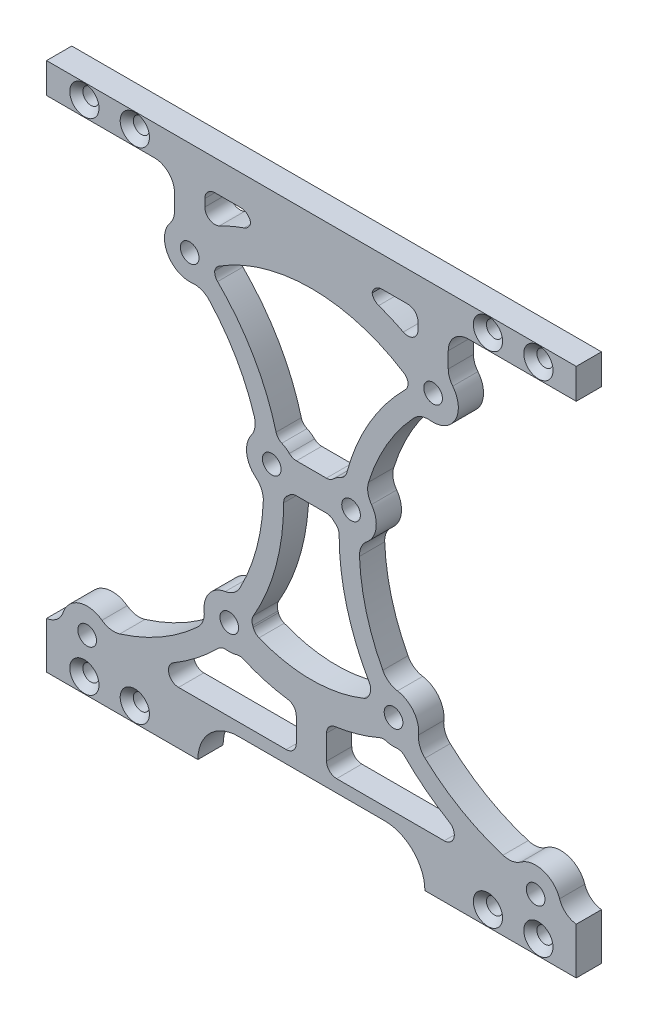
from build123d import *

# Parameters (mm, degrees)
SKETCH_1_R           = 1.85
SKETCH_1_R_2         = 37
SKETCH_1_R_3         = 2.1
EXTRUDE_1_DEPTH      = 5
FILLET_1_R           = 2.5
SKETCH_2_W           = 105
SKETCH_2_H           = 2.5
CUT_EXTRUDE_1_DEPTH  = 10
SKETCH_3_OUTSIDE_W   = 247.662
SKETCH_3_OUTSIDE_H   = 157.662
SKETCH_3_OUTSIDE_W_2 = 105
SKETCH_3_OUTSIDE_H_2 = 105
CUT_EXTRUDE_2_DEPTH  = 10
SKETCH_5_R           = 1.6
CUT_EXTRUDE_3_DEPTH  = 10
SKETCH_6_OUTSIDE_W   = 136.716
SKETCH_6_OUTSIDE_H   = 136.716
CUT_EXTRUDE_4_DEPTH  = 10
FILLET_2_R           = 4
FILLET_3_R           = 2
CUT_EXTRUDE_5_DEPTH  = 10
CHAMFER_1_SIZE       = 1.3


with BuildPart() as part:
    # 草图1 → 凸台-拉伸1 (new body)
    with BuildSketch(Plane.XY):
        with BuildLine():
            Line((-55, 49.749371855), (-55, 55))
            Line((-55, 55), (55, 55))
            Line((55, 55), (55, 49.749371855))
            ThreePointArc((55, 49.749371855), (100, 0), (55, -49.749371855))
            Line((55, -49.749371855), (55, -55))
            Line((55, -55), (-55, -55))
            Line((-55, -55), (-55, -49.749371855))
            ThreePointArc((-55, -49.749371855), (-100, 0), (-55, 49.749371855))
        make_face()
        with Locations((-44.452636831, -42.136406608)):
            Circle(SKETCH_1_R, mode=Mode.SUBTRACT)
        with Locations((-75.872360733, -33.717516962)):
            Circle(SKETCH_1_R, mode=Mode.SUBTRACT)
        with Locations((-92.136406608, -5.547363169)):
            Circle(SKETCH_1_R, mode=Mode.SUBTRACT)
        with Locations((-83.717516962, 25.872360733)):
            Circle(SKETCH_1_R, mode=Mode.SUBTRACT)
        with Locations((-55.547363169, 42.136406608)):
            Circle(SKETCH_1_R, mode=Mode.SUBTRACT)
        with Locations((-24.127639267, 33.717516962)):
            Circle(SKETCH_1_R, mode=Mode.SUBTRACT)
        with Locations((-7.863593392, 5.547363169)):
            Circle(SKETCH_1_R, mode=Mode.SUBTRACT)
        with Locations((-16.282483038, -25.872360733)):
            Circle(SKETCH_1_R, mode=Mode.SUBTRACT)
        with Locations((-50, 0)):
            Circle(SKETCH_1_R_2, mode=Mode.SUBTRACT)
        with Locations(Location((50, 0, 0), (0, 0, 180))):
            Circle(SKETCH_1_R_2, mode=Mode.SUBTRACT)
        with Locations(Location((16.282483038, -25.872360733, 0), (0, 0, 180))):
            Circle(SKETCH_1_R, mode=Mode.SUBTRACT)
        with Locations(Location((7.863593392, 5.547363169, 0), (0, 0, 180))):
            Circle(SKETCH_1_R, mode=Mode.SUBTRACT)
        with Locations(Location((24.127639267, 33.717516962, 0), (0, 0, 180))):
            Circle(SKETCH_1_R, mode=Mode.SUBTRACT)
        with Locations(Location((55.547363169, 42.136406608, 0), (0, 0, 180))):
            Circle(SKETCH_1_R, mode=Mode.SUBTRACT)
        with Locations(Location((83.717516962, 25.872360733, 0), (0, 0, 180))):
            Circle(SKETCH_1_R, mode=Mode.SUBTRACT)
        with Locations(Location((92.136406608, -5.547363169, 0), (0, 0, 180))):
            Circle(SKETCH_1_R, mode=Mode.SUBTRACT)
        with Locations(Location((75.872360733, -33.717516962, 0), (0, 0, 180))):
            Circle(SKETCH_1_R, mode=Mode.SUBTRACT)
        with Locations(Location((44.452636831, -42.136406608, 0), (0, 0, 180))):
            Circle(SKETCH_1_R, mode=Mode.SUBTRACT)
        with Locations(Location((8, -47.5, 0), (0, 0, 180))):
            Circle(SKETCH_1_R_3, mode=Mode.SUBTRACT)
        with Locations((-8, -47.5)):
            Circle(SKETCH_1_R_3, mode=Mode.SUBTRACT)
    extrude(amount=EXTRUDE_1_DEPTH)

    # 圆角1
    fillet_1_edges = [part.edges().sort_by_distance(p)[0] for p in [
        (-55, 49.749371855, 2.5),
        (-55, 55, 2.5),
        (55, 55, 2.5),
        (55, 49.749371855, 2.5),
        (55, -49.749371855, 2.5),
        (55, -55, 2.5),
        (-55, -55, 2.5),
        (-55, -49.749371855, 2.5),
    ]]
    fillet(fillet_1_edges, radius=FILLET_1_R)

    # 草图2 → 切除-拉伸1 (cut)
    with BuildSketch(Plane.XY.offset(5)):
        with Locations((0, 53.75)):
            Rectangle(SKETCH_2_W, SKETCH_2_H)
        with Locations((0, -53.75)):
            Rectangle(SKETCH_2_W, SKETCH_2_H)
    extrude(amount=-CUT_EXTRUDE_1_DEPTH, mode=Mode.SUBTRACT)

    # 草图3 outside → 切除-拉伸2 (cut)
    with BuildSketch(Plane.XY.offset(5)):
        Rectangle(SKETCH_3_OUTSIDE_W, SKETCH_3_OUTSIDE_H)
        Rectangle(SKETCH_3_OUTSIDE_W_2, SKETCH_3_OUTSIDE_H_2, mode=Mode.SUBTRACT)
    extrude(amount=-CUT_EXTRUDE_2_DEPTH, mode=Mode.SUBTRACT)

    # 草图5 → 切除-拉伸3 (cut)
    with BuildSketch(Plane.XY.offset(5)):
        with Locations((-45, 49.5)):
            Circle(SKETCH_5_R)
        with Locations((-35, 49.5)):
            Circle(SKETCH_5_R)
        with Locations((35, 49.5)):
            Circle(SKETCH_5_R)
        with Locations((45, 49.5)):
            Circle(SKETCH_5_R)
        with Locations((45, -49.5)):
            Circle(SKETCH_5_R)
        with Locations((35, -49.5)):
            Circle(SKETCH_5_R)
        with Locations((-35, -49.5)):
            Circle(SKETCH_5_R)
        with Locations((-45, -49.5)):
            Circle(SKETCH_5_R)
    extrude(amount=-CUT_EXTRUDE_3_DEPTH, mode=Mode.SUBTRACT)

    # 草图6 outside → 切除-拉伸4 (cut)
    # profile 1 of 7: a face of its own
    with BuildSketch(Plane.XY.offset(5)):
        Rectangle(SKETCH_6_OUTSIDE_W, SKETCH_6_OUTSIDE_H)
        with BuildLine():
            Line((-52.5, 46.5), (-52.5, 52.5))
            Line((-52.5, 52.5), (52.5, 52.5))
            Line((52.5, 52.5), (52.5, 46.5))
            Line((52.5, 46.5), (27.127639267, 46.5))
            Line((27.127639267, 46.5), (27.127639267, 37.717516962))
            ThreePointArc((27.127639267, 37.717516962), (28.39848316, 31.117537647), (21.951951232, 29.215697156))
            ThreePointArc((21.951951232, 29.215697156), (14.925971147, 20.25), (10.67443969, 9.682474182))
            ThreePointArc((10.67443969, 9.682474182), (12.820817698, 4.894732208), (9.508416941, 0.825652093))
            ThreePointArc((9.508416941, 0.825652093), (10.880004035, -10.482171327), (15.346086478, -20.960827216))
            ThreePointArc((15.346086478, -20.960827216), (20.249249739, -22.828553588), (20.784302844, -28.048048768))
            ThreePointArc((20.784302844, -28.048048768), (29.75, -35.074028853), (40.317525818, -39.32556031))
            ThreePointArc((40.317525818, -39.32556031), (46.430040326, -37.544035171), (49.336261078, -43.208887012))
            Line((49.336261078, -43.208887012), (52.5, -43.263142848))
            Line((52.5, -43.263142848), (52.5, -52.5))
            Line((52.5, -52.5), (-52.5, -52.5))
            Line((-52.5, -52.5), (-52.5, -43.263142848))
            Line((-52.5, -43.263142848), (-49.336261078, -43.208887012))
            ThreePointArc((-49.336261078, -43.208887012), (-46.430040326, -37.544035171), (-40.317525818, -39.32556031))
            ThreePointArc((-40.317525818, -39.32556031), (-29.75, -35.074028853), (-20.784302844, -28.048048768))
            ThreePointArc((-20.784302844, -28.048048768), (-20.249249739, -22.828553588), (-15.346086478, -20.960827216))
            ThreePointArc((-15.346086478, -20.960827216), (-10.880004035, -10.482171327), (-9.508416941, 0.825652093))
            ThreePointArc((-9.508416941, 0.825652093), (-12.820817698, 4.894732208), (-10.67443969, 9.682474182))
            ThreePointArc((-10.67443969, 9.682474182), (-14.925971147, 20.25), (-21.951951232, 29.215697156))
            ThreePointArc((-21.951951232, 29.215697156), (-28.39848316, 31.117537647), (-27.127639267, 37.717516962))
            Line((-27.127639267, 37.717516962), (-27.127639267, 46.5))
            Line((-27.127639267, 46.5), (-52.5, 46.5))
        make_face(mode=Mode.SUBTRACT)
    # profile 2 of 7: a face of its own
    with BuildSketch(Plane.XY.offset(5)):
        with BuildLine():
            Line((-3.863593392, 2.547363169), (3.863593392, 2.547363169))
            ThreePointArc((3.863593392, 2.547363169), (4.611266381, 1.749683744), (5.514440588, 1.133580086))
            ThreePointArc((5.514440588, 1.133580086), (7.01630073, -11.517447507), (12.041165491, -23.224488858))
            ThreePointArc((12.041165491, -23.224488858), (11.591694493, -24.141319767), (11.337848721, -25.130342222))
            ThreePointArc((11.337848721, -25.130342222), (0, -27.569564991), (-11.337848721, -25.130342222))
            ThreePointArc((-11.337848721, -25.130342222), (-11.591694493, -24.141319767), (-12.041165491, -23.224488858))
            ThreePointArc((-12.041165491, -23.224488858), (-7.01630073, -11.517447507), (-5.514440588, 1.133580086))
            ThreePointArc((-5.514440588, 1.133580086), (-4.611266381, 1.749683744), (-3.863593392, 2.547363169))
        make_face()
    # profile 3 of 7: a face of its own
    with BuildSketch(Plane.XY.offset(5)):
        with BuildLine():
            Line((-3.863593392, 8.547363169), (3.863593392, 8.547363169))
            ThreePointArc((3.863593392, 8.547363169), (5.134787124, 9.737066781), (6.736857152, 10.418755726))
            ThreePointArc((6.736857152, 10.418755726), (11.461869532, 22.25), (19.345521441, 32.257602891))
            ThreePointArc((19.345521441, 32.257602891), (19.178901092, 33.003380788), (19.127872778, 33.765839392))
            ThreePointArc((19.127872778, 33.765839392), (0, 39.637800499), (-19.127872778, 33.765839392))
            ThreePointArc((-19.127872778, 33.765839392), (-19.178901092, 33.003380788), (-19.345521441, 32.257602891))
            ThreePointArc((-19.345521441, 32.257602891), (-11.461869532, 22.25), (-6.736857152, 10.418755726))
            ThreePointArc((-6.736857152, 10.418755726), (-5.134787124, 9.737066781), (-3.863593392, 8.547363169))
        make_face()
    # profile 4 of 7: a face of its own
    with BuildSketch(Plane.XY.offset(5)):
        with BuildLine():
            Line((21.127639267, 46.5), (21.127639267, 39.618847204))
            ThreePointArc((21.127639267, 39.618847204), (16.695210543, 41.996136951), (12, 43.799724734))
            Line((12, 43.799724734), (12, 46.5))
            Line((12, 46.5), (21.127639267, 46.5))
        make_face()
    # profile 5 of 7: a face of its own
    with BuildSketch(Plane.XY.offset(5)):
        with BuildLine():
            Line((-21.127639267, 46.5), (-21.127639267, 39.618847204))
            ThreePointArc((-21.127639267, 39.618847204), (-16.695210543, 41.996136952), (-12, 43.799724734))
            Line((-12, 43.799724734), (-12, 46.5))
            Line((-12, 46.5), (-21.127639267, 46.5))
        make_face()
    # profile 6 of 7: a face of its own
    with BuildSketch(Plane.XY.offset(5)):
        with BuildLine():
            Line((3, -42.025445209), (3, -33.435246279))
            ThreePointArc((3, -33.435246279), (8.731461368, -32.414152404), (14.200321769, -30.418194479))
            ThreePointArc((14.200321769, -30.418194479), (15.949683646, -30.861272895), (17.742397109, -30.654478559))
            ThreePointArc((17.742397109, -30.654478559), (25.875392665, -37.393225602), (35.367435119, -42.025445209))
            Line((35.367435119, -42.025445209), (3, -42.025445209))
        make_face()
    # profile 7 of 7: a face of its own
    with BuildSketch(Plane.XY.offset(5)):
        with BuildLine():
            Line((-3, -42.025445209), (-3, -33.435246279))
            ThreePointArc((-3, -33.435246279), (-8.731461368, -32.414152404), (-14.200321769, -30.418194479))
            ThreePointArc((-14.200321769, -30.418194479), (-15.949683646, -30.861272895), (-17.742397109, -30.654478559))
            ThreePointArc((-17.742397109, -30.654478559), (-25.875392665, -37.393225602), (-35.367435119, -42.025445209))
            Line((-35.367435119, -42.025445209), (-3, -42.025445209))
        make_face()
    extrude(amount=-CUT_EXTRUDE_4_DEPTH, mode=Mode.SUBTRACT)

    # 圆角2
    # the kernel refuses this fillet: 4 mm, written as the material it adds along each edge
    with BuildSketch(Plane(origin=(27.127639267, 46.5, 5), x_dir=(0, -1, 0), z_dir=(0, 0, -1)), Plane(origin=(-27.127639267, 46.5, 5), x_dir=(-1, 0, 0), z_dir=(0, 0, -1))) as fillet_2_piece_1:
        with BuildLine():
            CenterArc((FILLET_2_R, -FILLET_2_R), FILLET_2_R, 90, 90)
            Line((0, -FILLET_2_R), (-FILLET_2_R * 0.02, -FILLET_2_R))
            Line((-FILLET_2_R * 0.02, -FILLET_2_R), (-FILLET_2_R * 0.02, FILLET_2_R * 0.02))
            Line((-FILLET_2_R * 0.02, FILLET_2_R * 0.02), (FILLET_2_R, FILLET_2_R * 0.02))
            Line((FILLET_2_R, FILLET_2_R * 0.02), (FILLET_2_R, 0))
        make_face()
    extrude(amount=5)
    with BuildSketch(Plane(origin=(27.127639267, 37.717516962, 5), x_dir=(0.7197794183557561, -0.6942028442115816, 0), z_dir=(0, 0, -1))) as fillet_2_piece_2:
        with BuildLine():
            CenterArc((1.728924741, -3.969380965), FILLET_2_R, 97.093830543, 38.942441269)
            Line((-1.150192932, -1.192569588), (-1.207775286, -1.13703336))
            Line((-1.207775286, -1.13703336), (-0.057582353, 0.055536228))
            Line((-0.057582353, 0.055536228), (0.00987957, 0.079387619))
            ThreePointArc((0.00987957, 0.079387619), (0.617473122, 0.041726206), (1.225066674, 0.079387619))
            Line((1.225066674, 0.079387619), (1.234946244, 0))
        make_face()
    extrude(amount=5)
    with BuildSketch(Plane(origin=(21.951951232, 29.215697156, 5), x_dir=(-0.7002722102588733, -0.7138759216692716, 0), z_dir=(0, 0, -1)), Plane(origin=(9.508416941, 0.825652093, 5), x_dir=(0.009619276587599333, -0.9999537336886799, 0), z_dir=(0, 0, -1)), Plane(origin=(20.784302844, -28.048048768, 5), x_dir=(0.7138759216692725, -0.7002722102588728, 0), z_dir=(0, 0, -1)), Plane(origin=(-10.67443969, 9.682474182, 5), x_dir=(-0.2680985781861885, 0.9633914844830964, 0), z_dir=(0, 0, -1)), Plane(origin=(-40.317525818, -39.32556031, 5), x_dir=(0.9633914844830966, 0.26809857818618743, 0), z_dir=(0, 0, -1)), Plane(origin=(-15.346086478, -20.960827216, 5), x_dir=(0.4916463289534472, 0.8707949742772971, 0), z_dir=(0, 0, -1))) as fillet_2_piece_3:
        with BuildLine():
            CenterArc((2.310216037, -3.998199258), FILLET_2_R, 88.280707854, 53.260802944)
            Line((-0.822019817, -1.510409363), (-0.884664534, -1.460653566))
            ThreePointArc((-0.884664534, -1.460653566), (-0.415857434, -0.752566482), (-0.075797034, 0.025589248))
            Line((-0.075797034, 0.025589248), (-0.002400224, 0.079963985))
            ThreePointArc((-0.002400224, 0.079963985), (1.21511363, 0.098232513), (2.432627484, 0.079963985))
            Line((2.432627484, 0.079963985), (2.430227259, 0))
        make_face()
    extrude(amount=5)
    with BuildSketch(Plane(origin=(10.67443969, 9.682474182, 5), x_dir=(0.7180316053896928, -0.6960104982408675, 0), z_dir=(0, 0, -1)), Plane(origin=(15.346086478, -20.960827216, 5), x_dir=(0.9998787603604599, 0.01557127419417161, 0), z_dir=(0, 0, -1)), Plane(origin=(40.317525818, -39.32556031, 5), x_dir=(0.6960104982408613, 0.7180316053896988, 0), z_dir=(0, 0, -1)), Plane(origin=(-21.951951232, 29.215697156, 5), x_dir=(-0.9617785754721017, -0.2738283618671649, 0), z_dir=(0, 0, -1)), Plane(origin=(-9.508416941, 0.825652093, 5), x_dir=(-0.8737060442737377, 0.486454261158783, 0), z_dir=(0, 0, -1)), Plane(origin=(-20.784302844, -28.048048768, 5), x_dir=(-0.27382836186716875, 0.9617785754721005, 0), z_dir=(0, 0, -1))) as fillet_2_piece_4:
        with BuildLine():
            CenterArc((2.40745175, -3.940415145), FILLET_2_R, 99.901846003, 53.260802944)
            Line((-1.161715059, -2.134577863), (-1.233098396, -2.098461117))
            ThreePointArc((-1.233098396, -2.098461117), (-0.667139562, -1.020331105), (-0.06908859, 0.040333196))
            Line((-0.06908859, 0.040333196), (0.013756867, 0.078808303))
            ThreePointArc((0.013756867, 0.078808303), (0.859804196, 0.005518931), (1.705851525, 0.078808303))
            Line((1.705851525, 0.078808303), (1.719608393, 0))
        make_face()
    extrude(amount=5)
    with BuildSketch(Plane(origin=(49.336261078, -43.208887012, 5), x_dir=(0.9998529835678932, -0.017146756264151214, 0), z_dir=(0, 0, -1))) as fillet_2_piece_5:
        with BuildLine():
            CenterArc((3.587897314, -3.977497212), FILLET_2_R, 96.08036444, 64.523262595)
            Line((-0.185077419, -2.649091525), (-0.260536913, -2.622523411))
            ThreePointArc((-0.260536913, -2.622523411), (0.00674057, -1.331481858), (-0.078420733, -0.015817351))
            Line((-0.078420733, -0.015817351), (0, 0.08))
            ThreePointArc((0, 0.08), (1.582102056, 0.08), (3.155730248, 0.079549944))
            Line((3.155730248, 0.079549944), (3.164204112, 0))
        make_face()
    extrude(amount=5)
    with BuildSketch(Plane(origin=(-27.127639267, 37.717516962, 5), x_dir=(0, 1, 0), z_dir=(0, 0, -1))) as fillet_2_piece_6:
        with BuildLine():
            CenterArc((1.656854249, -4), FILLET_2_R, 90, 38.942441269)
            Line((-0.857303195, -0.888888889), (-0.907586344, -0.826666667))
            ThreePointArc((-0.907586344, -0.826666667), (-0.458685262, -0.415477994), (-0.064, 0.048))
            Line((-0.064, 0.048), (0, 0.08))
            Line((0, 0.08), (1.656854249, 0.08))
            Line((1.656854249, 0.08), (1.656854249, 0))
        make_face()
    extrude(amount=5)
    with BuildSketch(Plane(origin=(-49.336261078, -43.208887012, 5), x_dir=(0.05257929400739702, 0.9986167522336503, 0), z_dir=(0, 0, -1))) as fillet_2_piece_7:
        with BuildLine():
            CenterArc((3.717768354, -3.856382978), FILLET_2_R, 105.399926602, 64.523262595)
            Line((-0.220527946, -3.156509954), (-0.299293872, -3.142512494))
            ThreePointArc((-0.299293872, -3.142512494), (-0.190069443, -1.572679409), (-0.07980547, 0.005575568))
            Line((-0.07980547, 0.005575568), (0.021244391, 0.07712766))
            ThreePointArc((0.021244391, 0.07712766), (1.327774412, -0.099521278), (2.634304434, 0.07712766))
            Line((2.634304434, 0.07712766), (2.655548824, 0))
        make_face()
    extrude(amount=5)

    # 圆角3
    # the kernel refuses this fillet: 2 mm, written as the material it adds along each edge
    with BuildSketch(Plane(origin=(21.127639267, 46.5, 5), x_dir=(0, -1, 0), z_dir=(0, 0, -1)), Plane(origin=(-3, -42.025445209, 5), x_dir=(-1, 0, 0), z_dir=(0, 0, -1)), Plane(origin=(-21.127639267, 46.5, 5), x_dir=(1, 0, 0), z_dir=(0, 0, -1))) as fillet_3_piece_1:
        with BuildLine():
            CenterArc((FILLET_3_R, FILLET_3_R), FILLET_3_R, 180, 90)
            Line((0, FILLET_3_R), (0, 0))
            Line((0, 0), (FILLET_3_R, 0))
        make_face()
    extrude(amount=5)
    with BuildSketch(Plane(origin=(12, 46.5, 5), x_dir=(0, -1, 0), z_dir=(0, 0, -1)), Plane(origin=(3, -42.025445209, 5), x_dir=(1, 0, 0), z_dir=(0, 0, -1)), Plane(origin=(-12, 46.5, 5), x_dir=(-1, 0, 0), z_dir=(0, 0, -1))) as fillet_3_piece_2:
        with BuildLine():
            CenterArc((FILLET_3_R, -FILLET_3_R), FILLET_3_R, 90, 90)
            Line((0, -FILLET_3_R), (0, 0))
            Line((0, 0), (FILLET_3_R, 0))
        make_face()
    extrude(amount=5)
    with BuildSketch(Plane(origin=(12, 43.799724734, 5), x_dir=(0.948752916473089, -0.31601883406500947, 0), z_dir=(0, 0, -1))) as fillet_3_piece_3:
        with BuildLine():
            CenterArc((1.441955653, -1.99969211), FILLET_3_R, 91.005370328, 70.572298842)
            Line((-0.45555018, -1.367654442), (0, 0))
            ThreePointArc((0, 0), (0.703431704, -0.006171724), (1.406863409, 0))
        make_face()
    extrude(amount=5)
    with BuildSketch(Plane(origin=(21.127639267, 39.618847204, 5), x_dir=(-0.8710769216116074, 0.491146614195441, 0), z_dir=(0, 0, -1))) as fillet_3_piece_4:
        with BuildLine():
            CenterArc((3.422706818, 1.998264653), FILLET_3_R, 150.584026907, 117.029001738)
            Line((1.680552975, 2.980557881), (0, 0))
            ThreePointArc((0, 0), (1.66970495, 0.034785411), (3.339409899, 0))
        make_face()
    extrude(amount=5)
    with BuildSketch(Plane(origin=(19.345521441, 32.257602891, 5), x_dir=(-0.20291231245836217, 0.9791969125016684, 0), z_dir=(0, 0, -1)), Plane(origin=(5.514440588, 1.133580086, 5), x_dir=(-0.8358774490724128, 0.5489161048213068, 0), z_dir=(0, 0, -1))) as fillet_3_piece_5:
        with BuildLine():
            CenterArc((1.102062635, -1.99154782), FILLET_3_R, 95.26938654, 51.52889957)
            ThreePointArc((-0.571433232, -0.896371314), (-0.283039939, -0.449892028), (0, 0))
            ThreePointArc((0, 0), (0.459192765, -0.021130449), (0.918385529, 0))
        make_face()
    extrude(amount=5)
    with BuildSketch(Plane(origin=(19.127872778, 33.765839392, 5), x_dir=(-0.8359583946344881, 0.5487928228759278, 0), z_dir=(0, 0, -1))) as fillet_3_piece_6:
        with BuildLine():
            CenterArc((0.978448281, -1.999781408), FILLET_3_R, 89.152882162, 48.634104073)
            ThreePointArc((-0.502855734, -0.656003741), (-0.23784894, -0.338410716), (0, 0))
            ThreePointArc((0, 0), (0.504008597, 0.00372595), (1.008017194, 0))
        make_face()
    extrude(amount=5)
    with BuildSketch(Plane(origin=(6.736857152, 10.418755726, 5), x_dir=(0.24572473726363142, 0.9693396481609113, 0), z_dir=(0, 0, -1)), Plane(origin=(12.041165491, -23.224488858, 5), x_dir=(-0.5116730104631513, 0.8591802665119679, 0), z_dir=(0, 0, -1)), Plane(origin=(-17.742397109, -30.654478559, 5), x_dir=(-0.6974736888890193, -0.716610391571001, 0), z_dir=(0, 0, -1))) as fillet_3_piece_7:
        with BuildLine():
            CenterArc((1.086910952, -1.999857334), FILLET_3_R, 90.68436144, 51.52889957)
            ThreePointArc((-0.493682743, -0.77440902), (-0.229023571, -0.398563289), (0, 0))
            ThreePointArc((0, 0), (0.531511399, -0.00317432), (1.063022799, 0))
        make_face()
    extrude(amount=5)
    with BuildSketch(Plane(origin=(3.863593392, 8.547363169, 5), x_dir=(-1, 0, 0), z_dir=(0, 0, -1))) as fillet_3_piece_8:
        with BuildLine():
            CenterArc((0.898979486, 2), FILLET_3_R, 225.584691403, 44.415308597)
            ThreePointArc((-0.500728939, 0.571428571), (-0.239494813, 0.295239101), (0, 0))
            Line((0, 0), (0.898979486, 0))
        make_face()
    extrude(amount=5)
    with BuildSketch(Plane(origin=(3.863593392, 2.547363169, 5), x_dir=(-1, 0, 0), z_dir=(0, 0, -1))) as fillet_3_piece_9:
        with BuildLine():
            CenterArc((0.898979486, -2), FILLET_3_R, 90, 44.415308597)
            ThreePointArc((-0.500728939, -0.571428571), (-0.239494813, -0.295239101), (0, 0))
            Line((0, 0), (0.898979486, 0))
        make_face()
    extrude(amount=5)
    with BuildSketch(Plane(origin=(11.337848721, -25.130342222, 5), x_dir=(-0.9190863049834295, -0.39405629546031423, 0), z_dir=(0, 0, -1))) as fillet_3_piece_10:
        with BuildLine():
            CenterArc((0.997828534, 1.999647368), FILLET_3_R, 221.409904841, 49.666039082)
            ThreePointArc((-0.502164938, 0.676764311), (-0.236798968, 0.348980636), (0, 0))
            ThreePointArc((0, 0), (0.517691927, -0.00486095), (1.035383855, 0))
        make_face()
    extrude(amount=5)
    with BuildSketch(Plane(origin=(17.742397109, -30.654478559, 5), x_dir=(0.6974736888890263, -0.7166103915709943, 0), z_dir=(0, 0, -1)), Plane(origin=(-12.041165491, -23.224488858, 5), x_dir=(0.5116730104631689, 0.8591802665119572, 0), z_dir=(0, 0, -1)), Plane(origin=(-6.736857152, 10.418755726, 5), x_dir=(-0.2457247372636369, 0.9693396481609099, 0), z_dir=(0, 0, -1))) as fillet_3_piece_11:
        with BuildLine():
            CenterArc((1.086910952, 1.999857334), FILLET_3_R, 217.78673899, 51.52889957)
            ThreePointArc((-0.493682743, 0.77440902), (-0.229023571, 0.398563289), (0, 0))
            ThreePointArc((0, 0), (0.531511399, 0.00317432), (1.063022799, 0))
        make_face()
    extrude(amount=5)
    with BuildSketch(Plane(origin=(14.200321769, -30.418194479, 5), x_dir=(0.9358677137594841, -0.35235156072110185, 0), z_dir=(0, 0, -1))) as fillet_3_piece_12:
        with BuildLine():
            CenterArc((0.832550139, 1.995180723), FILLET_3_R, 225.705079113, 40.316590828)
            ThreePointArc((-0.564153538, 0.563671436), (-0.280402858, 0.283511061), (0, 0))
            ThreePointArc((0, 0), (0.346895891, 0.012048192), (0.693791782, 0))
        make_face()
    extrude(amount=5)
    with BuildSketch(Plane(origin=(3, -33.435246279, 5), x_dir=(0.9933647577372718, 0.11500633932775779, 0), z_dir=(0, 0, -1))) as fillet_3_piece_13:
        with BuildLine():
            CenterArc((1.781886975, 1.999335669), FILLET_3_R, 186.603990691, 81.919191349)
            Line((-0.20484254, 1.76932299), (0, 0))
            ThreePointArc((0, 0), (0.865171006, 0.011150654), (1.730342012, 0))
        make_face()
    extrude(amount=5)
    with BuildSketch(Plane(origin=(35.367435119, -42.025445209, 5), x_dir=(-0.9070624054514709, 0.42099619073881356, 0), z_dir=(0, 0, -1))) as fillet_3_piece_14:
        with BuildLine():
            CenterArc((9.038453016, -1.990110359), FILLET_3_R, 95.700225126, 149.402277714)
            Line((8.196460634, -3.80423517), (0, 0))
            ThreePointArc((0, 0), (4.419902848, -0.220044503), (8.839805697, 0))
        make_face()
    extrude(amount=5)
    with BuildSketch(Plane(origin=(-35.367435119, -42.025445209, 5), x_dir=(0.9070624054514711, 0.42099619073881334, 0), z_dir=(0, 0, -1))) as fillet_3_piece_15:
        with BuildLine():
            CenterArc((9.038453016, 1.990110359), FILLET_3_R, 114.89749716, 149.402277714)
            Line((8.196460634, 3.80423517), (0, 0))
            ThreePointArc((0, 0), (4.419902848, 0.220044503), (8.839805697, 0))
        make_face()
    extrude(amount=5)
    with BuildSketch(Plane(origin=(-3, -33.435246279, 5), x_dir=(-0.9933647577372713, 0.11500633932776186, 0), z_dir=(0, 0, -1))) as fillet_3_piece_16:
        with BuildLine():
            CenterArc((1.781886975, -1.999335669), FILLET_3_R, 91.47681796, 81.919191349)
            Line((-0.20484254, -1.76932299), (0, 0))
            ThreePointArc((0, 0), (0.865171006, -0.011150654), (1.730342012, 0))
        make_face()
    extrude(amount=5)
    with BuildSketch(Plane(origin=(-14.200321769, -30.418194479, 5), x_dir=(-0.9358677137594784, -0.352351560721117, 0), z_dir=(0, 0, -1))) as fillet_3_piece_17:
        with BuildLine():
            CenterArc((0.832550139, -1.995180723), FILLET_3_R, 93.978330058, 40.316590828)
            ThreePointArc((-0.564153538, -0.563671436), (-0.280402858, -0.283511061), (0, 0))
            ThreePointArc((0, 0), (0.346895891, -0.012048192), (0.693791782, 0))
        make_face()
    extrude(amount=5)
    with BuildSketch(Plane(origin=(-11.337848721, -25.130342222, 5), x_dir=(-0.2312147916239468, 0.9729027290198619, 0), z_dir=(0, 0, -1))) as fillet_3_piece_18:
        with BuildLine():
            CenterArc((1.011265822, 1.992885551), FILLET_3_R, 215.499788847, 49.666039082)
            ThreePointArc((-0.616969495, 0.83148564), (-0.31238843, 0.412846254), (0, 0))
            ThreePointArc((0, 0), (0.421360759, 0.017786124), (0.842721519, 0))
        make_face()
    extrude(amount=5)
    with BuildSketch(Plane(origin=(-5.514440588, 1.133580086, 5), x_dir=(0.8358774490724113, 0.548916104821309, 0), z_dir=(0, 0, -1)), Plane(origin=(-19.345521441, 32.257602891, 5), x_dir=(0.20291231245836677, 0.9791969125016674, 0), z_dir=(0, 0, -1))) as fillet_3_piece_19:
        with BuildLine():
            CenterArc((1.102062635, 1.99154782), FILLET_3_R, 213.20171389, 51.52889957)
            ThreePointArc((-0.571433232, 0.896371314), (-0.283039939, 0.449892028), (0, 0))
            ThreePointArc((0, 0), (0.459192765, 0.021130449), (0.918385529, 0))
        make_face()
    extrude(amount=5)
    with BuildSketch(Plane(origin=(-3.863593392, 2.547363169, 5), x_dir=(-0.6590478202650394, -0.7521010374968914, 0), z_dir=(0, 0, -1))) as fillet_3_piece_20:
        with BuildLine():
            CenterArc((0.911731605, -1.994219044), FILLET_3_R, 94.357396878, 44.415308597)
            Line((-0.59247047, -0.676123404), (0, 0))
            ThreePointArc((0, 0), (0.379888169, -0.014452389), (0.759776337, 0))
        make_face()
    extrude(amount=5)
    with BuildSketch(Plane(origin=(-19.127872778, 33.765839392, 5), x_dir=(-0.07302092807114355, -0.9973304086728876, 0), z_dir=(0, 0, -1))) as fillet_3_piece_21:
        with BuildLine():
            CenterArc((0.991874442, -1.993156243), FILLET_3_R, 94.741260853, 48.634104073)
            ThreePointArc((-0.61324765, -0.800016239), (-0.309580938, -0.397741362), (0, 0))
            ThreePointArc((0, 0), (0.413281018, -0.017109393), (0.826562035, 0))
        make_face()
    extrude(amount=5)
    with BuildSketch(Plane(origin=(-3.863593392, 8.547363169, 5), x_dir=(-0.6590478202650385, 0.752101037496892, 0), z_dir=(0, 0, -1))) as fillet_3_piece_22:
        with BuildLine():
            CenterArc((0.911731605, 1.994219044), FILLET_3_R, 221.227294524, 44.415308597)
            Line((-0.59247047, 0.676123404), (0, 0))
            ThreePointArc((0, 0), (0.379888169, 0.014452389), (0.759776337, 0))
        make_face()
    extrude(amount=5)
    with BuildSketch(Plane(origin=(-21.127639267, 39.618847204, 5), x_dir=(0, 1, 0), z_dir=(0, 0, -1))) as fillet_3_piece_23:
        with BuildLine():
            CenterArc((3.421693088, 2), FILLET_3_R, 152.970998262, 117.029001738)
            ThreePointArc((1.640139865, 2.908882895), (0.850370701, 1.437356711), (0, 0))
            Line((0, 0), (3.421693088, 0))
        make_face()
    extrude(amount=5)
    with BuildSketch(Plane(origin=(-12, 43.799724734, 5), x_dir=(0, 1, 0), z_dir=(0, 0, -1))) as fillet_3_piece_24:
        with BuildLine():
            CenterArc((1.441528577, -2), FILLET_3_R, 90, 70.572298842)
            ThreePointArc((-0.444595334, -1.334765762), (-0.216442226, -0.669333262), (0, 0))
            Line((0, 0), (1.441528577, 0))
        make_face()
    extrude(amount=5)

    # 草图7 → 切除-拉伸5 (cut)
    with BuildSketch(Plane.XY.offset(5)):
        with BuildLine():
            ThreePointArc((-22.5, -52.5), (-20.156854249, -46.843145751), (-14.5, -44.5))
            Line((-14.5, -44.5), (14.5, -44.5))
            ThreePointArc((14.5, -44.5), (20.156854249, -46.843145751), (22.5, -52.5))
            Line((22.5, -52.5), (-22.5, -52.5))
        make_face()
    extrude(amount=-CUT_EXTRUDE_5_DEPTH, mode=Mode.SUBTRACT)

    # 倒角1
    chamfer_1_edges = [part.edges().sort_by_distance(p)[0] for p in [
        (-36.6, 49.5, 5),
        (33.4, 49.5, 5),
        (43.4, 49.5, 5),
        (43.4, -49.5, 5),
        (33.4, -49.5, 5),
        (-36.6, -49.5, 5),
        (-46.6, -49.5, 5),
        (-46.6, 49.5, 5),
    ]]
    chamfer(chamfer_1_edges, length=CHAMFER_1_SIZE)


solid = part.part
